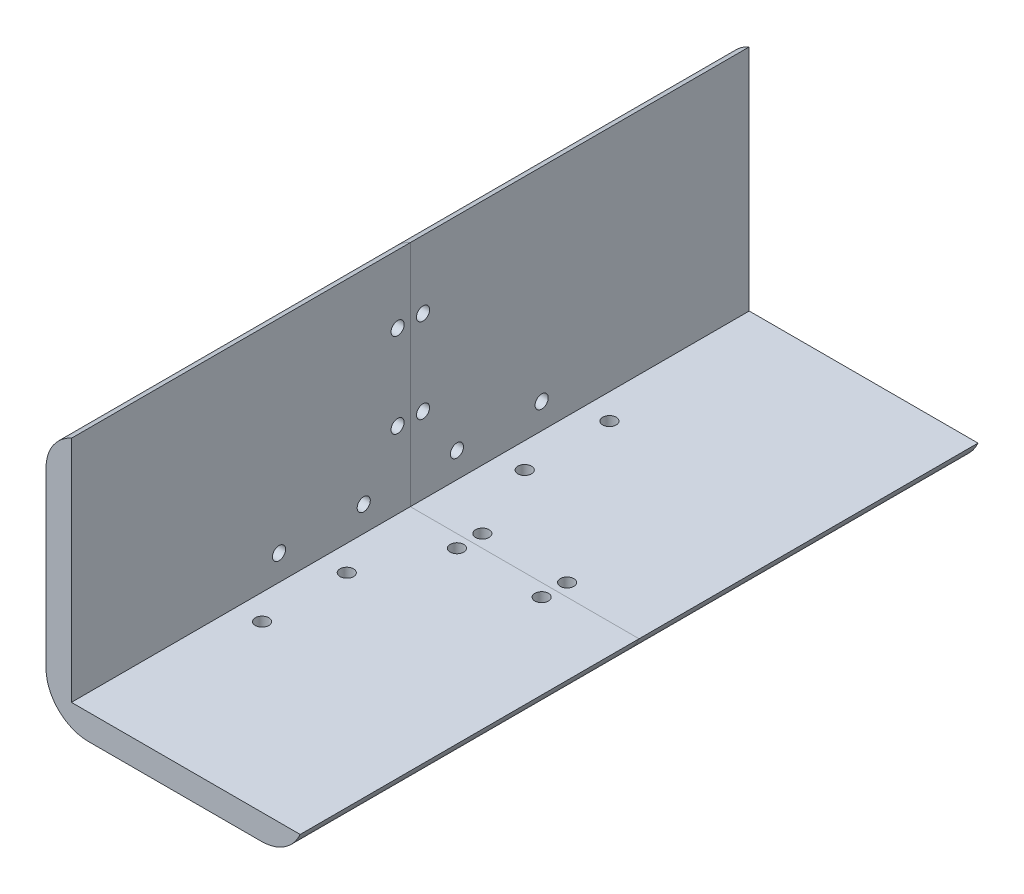
from build123d import *

# Parameters (mm, degrees)
EXTRUDE_1_DEPTH     = 40
FILLET_1_R          = 10
SKETCH_3_R          = 1.55
CUT_EXTRUDE_1_DEPTH = 94.808315196
SKETCH_4_R          = 1.6
CUT_EXTRUDE_2_DEPTH = 91.088845036
SKETCH_5_R          = 1.6
CUT_EXTRUDE_3_DEPTH = 94.808315196


with BuildPart() as part:
    # 草图1 → 凸台-拉伸1 (new, symmetric)
    with BuildSketch(Plane.XY):
        Polygon((0, 0), (0, 60), (6, 60), (6, 6), (60, 6), (60, 0), align=None)
    extrude(amount=EXTRUDE_1_DEPTH, both=True)

    # 圆角1
    # the kernel refuses this fillet: 10 mm, written as the material it takes off along each edge
    with BuildSketch(Plane(origin=(0, 60, 62.912878475), x_dir=(0, -1, 0), z_dir=(0, 0, -1))) as fillet_1_piece_1:
        with BuildLine():
            CenterArc((9.16515139, -10), FILLET_1_R, 90, 66.421821522)
            Line((0, -6), (-0.183303028, -5.92))
            ThreePointArc((-0.183303028, -5.92), (-0.2, -3), (-0.2, 0))
            Line((-0.2, 0), (0, 0.2))
            Line((0, 0.2), (9.16515139, 0.2))
            Line((9.16515139, 0.2), (9.16515139, 0))
        make_face()
    extrude(amount=125.82575695, mode=Mode.SUBTRACT)
    with BuildSketch(Plane(origin=(60, 0, -62.912878475), x_dir=(0, 1, 0), z_dir=(0, 0, 1))) as fillet_1_piece_2:
        with BuildLine():
            CenterArc((10, 9.16515139), FILLET_1_R, 180, 66.421821522)
            Line((0, 9.16515139), (-0.2, 9.16515139))
            Line((-0.2, 9.16515139), (-0.2, 0))
            Line((-0.2, 0), (0, -0.2))
            ThreePointArc((0, -0.2), (3, -0.2), (5.92, -0.183303028))
            Line((5.92, -0.183303028), (6, 0))
        make_face()
    extrude(amount=125.82575695, mode=Mode.SUBTRACT)
    with BuildSketch(Plane(origin=(0, 0, -65), x_dir=(0, 1, 0), z_dir=(0, 0, 1))) as fillet_1_piece_3:
        with BuildLine():
            CenterArc((FILLET_1_R, -FILLET_1_R), FILLET_1_R, 90, 90)
            Line((0, -FILLET_1_R), (-FILLET_1_R * 0.02, -FILLET_1_R))
            Line((-FILLET_1_R * 0.02, -FILLET_1_R), (-FILLET_1_R * 0.02, FILLET_1_R * 0.02))
            Line((-FILLET_1_R * 0.02, FILLET_1_R * 0.02), (FILLET_1_R, FILLET_1_R * 0.02))
            Line((FILLET_1_R, FILLET_1_R * 0.02), (FILLET_1_R, 0))
        make_face()
    extrude(amount=130, mode=Mode.SUBTRACT)

    # 草图3 → 切除-拉伸1 (cut, through all)
    with BuildSketch(Plane.ZY):
        with Locations((-37, 44)):
            Circle(SKETCH_3_R)
        with Locations((-37, 24)):
            Circle(SKETCH_3_R)
        with Locations((-29, 12)):
            Circle(SKETCH_3_R)
        with Locations((-9, 12)):
            Circle(SKETCH_3_R)
    extrude(amount=-CUT_EXTRUDE_1_DEPTH, mode=Mode.SUBTRACT)

    # 草图4 → 切除-拉伸2 (cut, through all)
    with BuildSketch(Plane(origin=(0, 6, 0), x_dir=(1, 0, 0), z_dir=(0, 1, 0))):
        with Locations(Location((12, -1, 0), (0, 0, 270))):
            Circle(SKETCH_4_R)
        with Locations(Location((12, 19, 0), (0, 0, 270))):
            Circle(SKETCH_4_R)
    extrude(amount=-CUT_EXTRUDE_2_DEPTH, mode=Mode.SUBTRACT)

    # 草图5 → 切除-拉伸3 (cut, through all)
    with BuildSketch(Plane.XZ):
        with Locations((20, -37)):
            Circle(SKETCH_5_R)
        with Locations((40, -37)):
            Circle(SKETCH_5_R)
    extrude(amount=-CUT_EXTRUDE_3_DEPTH, mode=Mode.SUBTRACT)


with BuildPart() as body_2:
    # 镜向1: mirrored copy
    add(part.part.mirror(Plane(origin=(0, 0, -40), x_dir=(1, 0, 0), z_dir=(0, 0, -1))))


solid = Compound([part.part, body_2.part])
